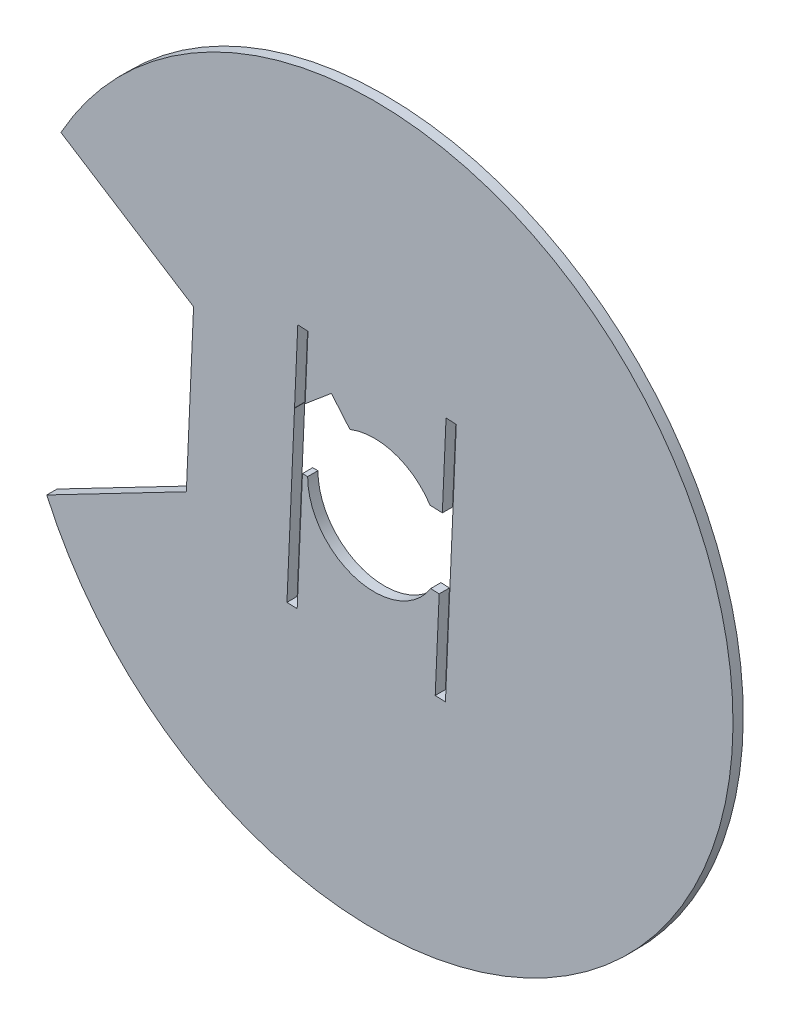
from build123d import *

# Parameters (mm, degrees)
ESQUISSE1_R             = 175
BOSS_EXTRU_1_DEPTH      = 5
ENL_V_START             = -10
ENL_V_MAT_EXTRU_1_DEPTH = 10


with BuildPart() as part:
    # Esquisse1 → Boss.-Extru.1 (new body)
    with BuildSketch(Plane.XY):
        Circle(ESQUISSE1_R)
        with BuildLine():
            Line((-20.91966999, 40.95026504), (-11.899961997, 30.243030676))
            ThreePointArc((-11.899961997, 30.243030676), (9.877796967, 30.962543937), (27.21544776, 17.764273225))
            Line((27.21544776, 17.764273225), (33.203827505, 17.5))
            Line((33.203827505, 17.5), (35.013781495, 58.513204539))
            Line((35.013781495, 58.513204539), (40.008919731, 58.292764062))
            Line((40.008919731, 58.292764062), (34.718348278, -61.590553601))
            Line((34.718348278, -61.590553601), (29.723210042, -61.370113123))
            Line((29.723210042, -61.370113123), (31.660744165, -17.465967651))
            Line((31.660744165, -17.465967651), (27.523349483, -17.283380261))
            ThreePointArc((27.523349483, -17.283380261), (-8.99280662, -31.231065129), (-32.5, 0))
            Line((-32.5, 0), (-35.034065472, 0))
            Line((-35.034065472, 0), (-37.611253378, -58.398575491))
            Line((-37.611253378, -58.398575491), (-42.606391614, -58.178135013))
            Line((-42.606391614, -58.178135013), (-38.906758812, 25.654822978))
            Line((-38.906758812, 25.654822978), (-38.97733315, 25.738601298))
            Line((-38.97733315, 25.738601298), (-38.900193886, 25.803582937))
            Line((-38.900193886, 25.803582937), (-37.315820161, 61.705182649))
            Line((-37.315820161, 61.705182649), (-32.320681925, 61.484742172))
            Line((-32.320681925, 61.484742172), (-33.702084088, 30.182438475))
            Line((-33.702084088, 30.182438475), (-20.91966999, 40.95026504))
        make_face(mode=Mode.SUBTRACT)
    extrude(amount=BOSS_EXTRU_1_DEPTH)

    # Esquisse2 → Enlèv. mat.-Extru.1 (cut)
    with BuildSketch(Plane.XY.offset(5).offset(ENL_V_START)):
        with BuildLine():
            Line((-88.148964429, 43.929034477), (-152.860619324, 85.197600084))
            ThreePointArc((-152.860619324, 85.197600084), (-174.829838257, 7.715416702), (-159.771465705, -71.400831554))
            Line((-159.771465705, -71.400831554), (-91.676012064, -35.993177298))
            Line((-91.676012064, -35.993177298), (-88.148964429, 43.929034477))
        make_face()
    extrude(amount=ENL_V_MAT_EXTRU_1_DEPTH, mode=Mode.SUBTRACT)


solid = part.part
